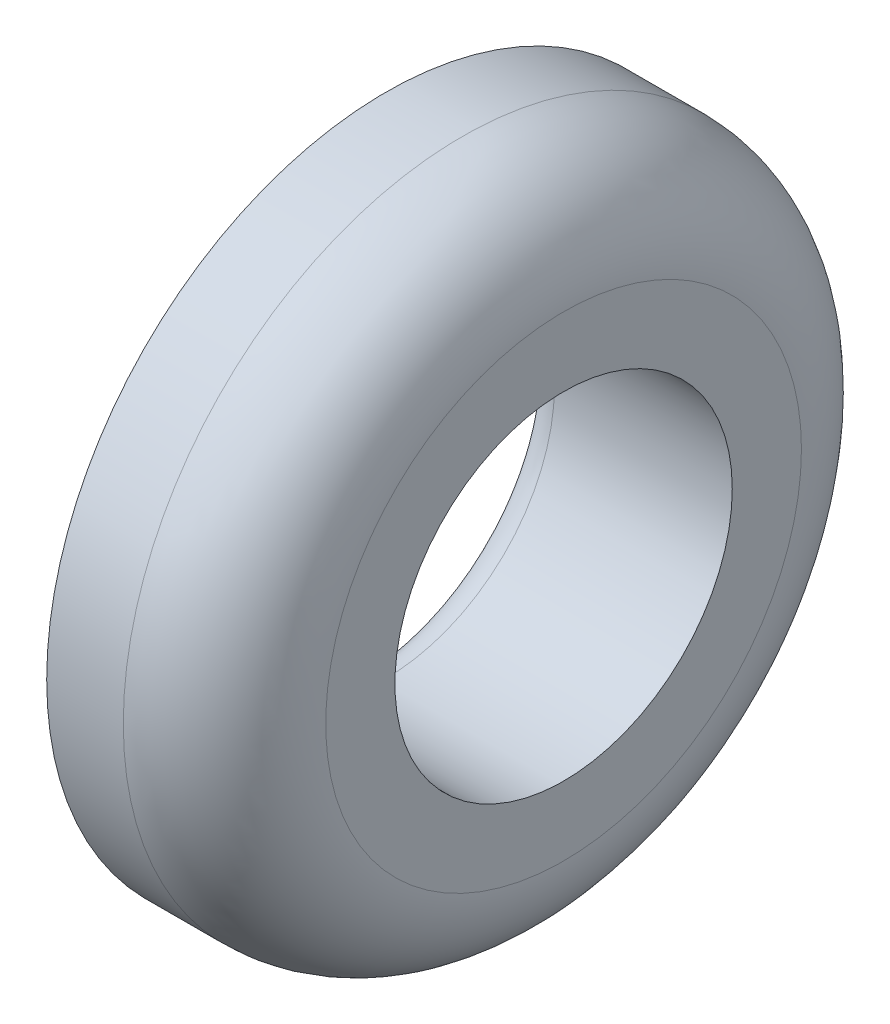
from build123d import *

# Parameters (mm, degrees)
SKETCH1_R           = 12.7635
SKETCH1_R_2         = 6.35
BOSS_EXTRUDE1_DEPTH = 7.9629
FILLET1_R           = 3.81
SKETCH2_R           = 12.7635
SKETCH2_R_2         = 11.802652822
CUT_EXTRUDE1_DEPTH  = 1.27
FILLET2_R           = 1.27


with BuildPart() as part:
    # Sketch1 → Boss-Extrude1 (new body)
    with BuildSketch(Plane(origin=(0, 0, 0), x_dir=(0, 0, -1), z_dir=(1, 0, 0))):
        Circle(SKETCH1_R)
        Circle(SKETCH1_R_2, mode=Mode.SUBTRACT)
    extrude(amount=BOSS_EXTRUDE1_DEPTH)

    # Fillet1
    fillet1_edges = [part.edges().sort_by_distance(p)[0] for p in [
        (7.9629, 0, 12.7635),
    ]]
    fillet(fillet1_edges, radius=FILLET1_R)

    # Sketch2 → Cut-Extrude1 (cut)
    with BuildSketch(Plane.ZY):
        Circle(SKETCH2_R)
        Circle(SKETCH2_R_2, mode=Mode.SUBTRACT)
    extrude(amount=-CUT_EXTRUDE1_DEPTH, mode=Mode.SUBTRACT)

    # Fillet2
    fillet2_edges = [part.edges().sort_by_distance(p)[0] for p in [
        (0, 0, -11.802652822),
        (0, 0, 6.35),
    ]]
    fillet(fillet2_edges, radius=FILLET2_R - 0.0001)  # a hair under: the kernel refuses the full size


solid = part.part
